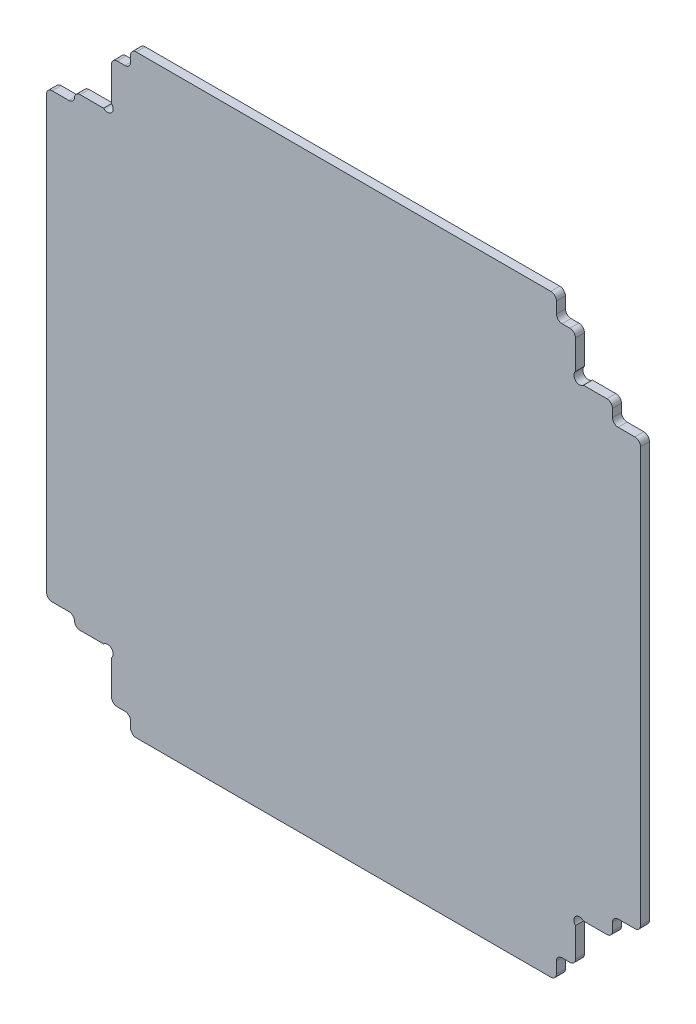
from build123d import *

# Parameters (mm, degrees)
SKETCH1_W          = 106
SKETCH1_H          = 106
MAINOUTLINE_DEPTH  = 1.6
RAILCUTOUTS_DEPTH  = 75.970394157
DOGBONES_DEPTH     = 75.970394157
SOLARFILLETS_DEPTH = 75.970394157
HANDLINGFILLETS_R  = 1


with BuildPart() as part:
    # Sketch1 → mainOutline (new body)
    with BuildSketch(Plane.XY):
        Rectangle(SKETCH1_W, SKETCH1_H)
    extrude(amount=MAINOUTLINE_DEPTH)

    # Sketch4 → railCutouts (cut, through all)
    with BuildSketch(Plane(origin=(0, 0, 0), x_dir=(-1, 0, 0), z_dir=(0, 0, -1))):
        Polygon((-41.4, -41.4), (-48, -41.4), (-48, -39), (-49.9975, -39), (-60.106513243, -39), (-60.106513243, -61.452099286), (-39, -61.452099286), (-39, -49.9), (-39, -49), (-41.4, -49), align=None)
        Polygon((39, -56.27525328), (39, -49.9), (41.4, -49.9), (41.4, -41.4), (48, -41.4), (48, -40.5), (55.517672261, -40.5), (55.517672261, -56.27525328), align=None)
        Polygon((55.383846757, 40.5), (48, 40.5), (48, 41.4), (41.4, 41.4), (41.4, 49.9), (39, 49.9), (39, 57.687687567), (55.383846757, 57.687687567), align=None)
        Polygon((-39, 59.880423019), (-39, 49.9), (-39, 49), (-41.4, 49), (-41.4, 41.4), (-48, 41.4), (-48, 39), (-49.9975, 39), (-56.842822937, 39), (-56.842822937, 59.880423019), align=None)
    extrude(amount=-RAILCUTOUTS_DEPTH, mode=Mode.SUBTRACT)

    # Sketch5 → dogbones (cut, through all)
    with BuildSketch(Plane(origin=(0, 0, 0), x_dir=(-1, 0, 0), z_dir=(0, 0, -1))):
        with BuildLine():
            Line((-41.4, -42.814213562), (-44.73741596, -46.151629522))
            ThreePointArc((-44.73741596, -46.151629522), (-46.151629522, -46.151629522), (-46.151629522, -44.73741596))
            Line((-46.151629522, -44.73741596), (-42.814213562, -41.4))
            ThreePointArc((-42.814213562, -41.4), (-41.4, -41.4), (-41.4, -42.814213562))
        make_face()
        with BuildLine():
            Line((42.814213562, -41.4), (44.747298889, -43.333085326))
            ThreePointArc((44.747298889, -43.333085326), (44.747298889, -44.747298889), (43.333085326, -44.747298889))
            Line((43.333085326, -44.747298889), (41.4, -42.814213562))
            ThreePointArc((41.4, -42.814213562), (41.4, -41.4), (42.814213562, -41.4))
        make_face()
        with BuildLine():
            Line((41.4, 42.814213562), (43.321909081, 44.736122643))
            ThreePointArc((43.321909081, 44.736122643), (44.736122643, 44.736122643), (44.736122643, 43.321909081))
            Line((44.736122643, 43.321909081), (42.814213562, 41.4))
            ThreePointArc((42.814213562, 41.4), (41.4, 41.4), (41.4, 42.814213562))
        make_face()
        with BuildLine():
            Line((-42.814213562, 41.4), (-44.503927418, 43.089713856))
            ThreePointArc((-44.503927418, 43.089713856), (-44.503927418, 44.503927418), (-43.089713856, 44.503927418))
            Line((-43.089713856, 44.503927418), (-41.4, 42.814213562))
            ThreePointArc((-41.4, 42.814213562), (-41.4, 41.4), (-42.814213562, 41.4))
        make_face()
    extrude(amount=-DOGBONES_DEPTH, mode=Mode.SUBTRACT)

    # Sketch6 → solarFillets (cut, through all)
    with BuildSketch(Plane(origin=(0, 0, 0), x_dir=(-1, 0, 0), z_dir=(0, 0, -1))):
        with BuildLine():
            Line((-40, 50), (-40, 53))
            ThreePointArc((-40, 53), (-39, 54), (-38, 53))
            Line((-38, 53), (-38, 50))
            ThreePointArc((-38, 50), (-39, 49), (-40, 50))
        make_face()
        with BuildLine():
            Line((-49, 38), (-53, 38))
            ThreePointArc((-53, 38), (-54, 39), (-53, 40))
            Line((-53, 40), (-49, 40))
            ThreePointArc((-49, 40), (-48, 39), (-49, 38))
        make_face()
        with BuildLine():
            Line((-49, -40), (-55.214202913, -40))
            ThreePointArc((-55.214202913, -40), (-56.214202913, -39), (-55.214202913, -38))
            Line((-55.214202913, -38), (-49, -38))
            ThreePointArc((-49, -38), (-48, -39), (-49, -40))
        make_face()
        with BuildLine():
            Line((-38, -50), (-38, -53.916094318))
            ThreePointArc((-38, -53.916094318), (-39, -54.916094318), (-40, -53.916094318))
            Line((-40, -53.916094318), (-40, -50))
            ThreePointArc((-40, -50), (-39, -49), (-38, -50))
        make_face()
        with BuildLine():
            Line((40, -50.9), (40, -54.538013421))
            ThreePointArc((40, -54.538013421), (39, -55.538013421), (38, -54.538013421))
            Line((38, -54.538013421), (38, -50.9))
            ThreePointArc((38, -50.9), (39, -49.9), (40, -50.9))
        make_face()
        with BuildLine():
            Line((49, -39.5), (54.202622605, -39.5))
            ThreePointArc((54.202622605, -39.5), (55.202622605, -40.5), (54.202622605, -41.5))
            Line((54.202622605, -41.5), (49, -41.5))
            ThreePointArc((49, -41.5), (48, -40.5), (49, -39.5))
        make_face()
        with BuildLine():
            Line((49, 41.5), (54.556563772, 41.5))
            ThreePointArc((54.556563772, 41.5), (55.556563772, 40.5), (54.556563772, 39.5))
            Line((54.556563772, 39.5), (49, 39.5))
            ThreePointArc((49, 39.5), (48, 40.5), (49, 41.5))
        make_face()
        with BuildLine():
            Line((38, 50.9), (38, 55.828092709))
            ThreePointArc((38, 55.828092709), (39, 56.828092709), (40, 55.828092709))
            Line((40, 55.828092709), (40, 50.9))
            ThreePointArc((40, 50.9), (39, 49.9), (38, 50.9))
        make_face()
    extrude(amount=-SOLARFILLETS_DEPTH, mode=Mode.SUBTRACT)

    # handlingFillets
    handlingfillets_edges = [part.edges().sort_by_distance(p)[0] for p in [
        (-41.4, -49.9, 0.8),
        (-38, -53, 0.8),
        (-53, -39.5, 0.8),
        (-48, -41.4, 0.8),
        (-48, 41.4, 0.8),
        (-53, 39.5, 0.8),
        (-41.4, 49.9, 0.8),
        (-38, 53, 0.8),
        (38, 53, 0.8),
        (41.4, 49, 0.8),
        (48, 41.4, 0.8),
        (53, 38, 0.8),
        (53, -38, 0.8),
        (48, -41.4, 0.8),
        (41.4, -49, 0.8),
        (38, -53, 0.8),
    ]]
    fillet(handlingfillets_edges, radius=HANDLINGFILLETS_R)


solid = part.part
